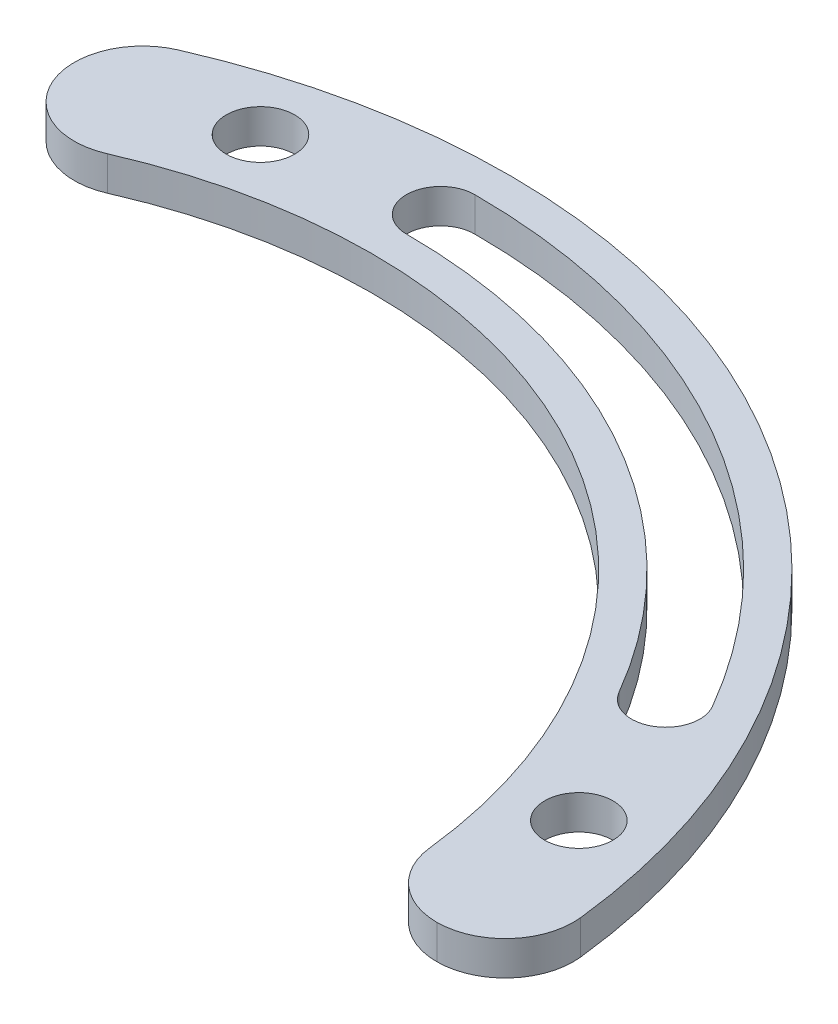
from build123d import *

# Parameters (mm, degrees)
SKETCH_1_R      = 1
EXTRUDE_1_DEPTH = 1
FILLET_1_R      = 2


with BuildPart() as part:
    # 草图1 → 凸台-拉伸1 (new body)
    with BuildSketch(Plane(origin=(0, 0, 0), x_dir=(1, 0, 0), z_dir=(0, 1, 0))):
        with BuildLine():
            Line((20, 0), (16, 0))
            ThreePointArc((16, 0), (8, 13.856406461), (-8, 13.856406461))
            Line((-8, 13.856406461), (-10, 17.320508076))
            ThreePointArc((-10, 17.320508076), (10, 17.320508076), (20, 0))
        make_face()
        with Locations(Location((-4.658742812, 17.386664873, 0), (0, 0, 270))):
            Circle(SKETCH_1_R, mode=Mode.SUBTRACT)
        with Locations(Location((17.386664873, 4.658742812, 0), (0, 0, 270))):
            Circle(SKETCH_1_R, mode=Mode.SUBTRACT)
        with BuildLine():
            ThreePointArc((16.454482672, 9.5), (9.5, 16.454482672), (0, 19))
            ThreePointArc((0, 19), (-1, 18), (0, 17))
            ThreePointArc((0, 17), (8.5, 14.722431864), (14.722431864, 8.5))
            ThreePointArc((14.722431864, 8.5), (16.088457268, 8.133974596), (16.454482672, 9.5))
        make_face(mode=Mode.SUBTRACT)
    extrude(amount=EXTRUDE_1_DEPTH)

    # 圆角1
    fillet_1_edges = [part.edges().sort_by_distance(p)[0] for p in [
        (-8, 0.5, -13.856406461),
        (-10, 0.5, -17.320508076),
        (16, 0.5, 0),
        (20, 0.5, 0),
    ]]
    fillet(fillet_1_edges, radius=FILLET_1_R - 0.0001)  # a hair under: the kernel refuses the full size


solid = part.part
